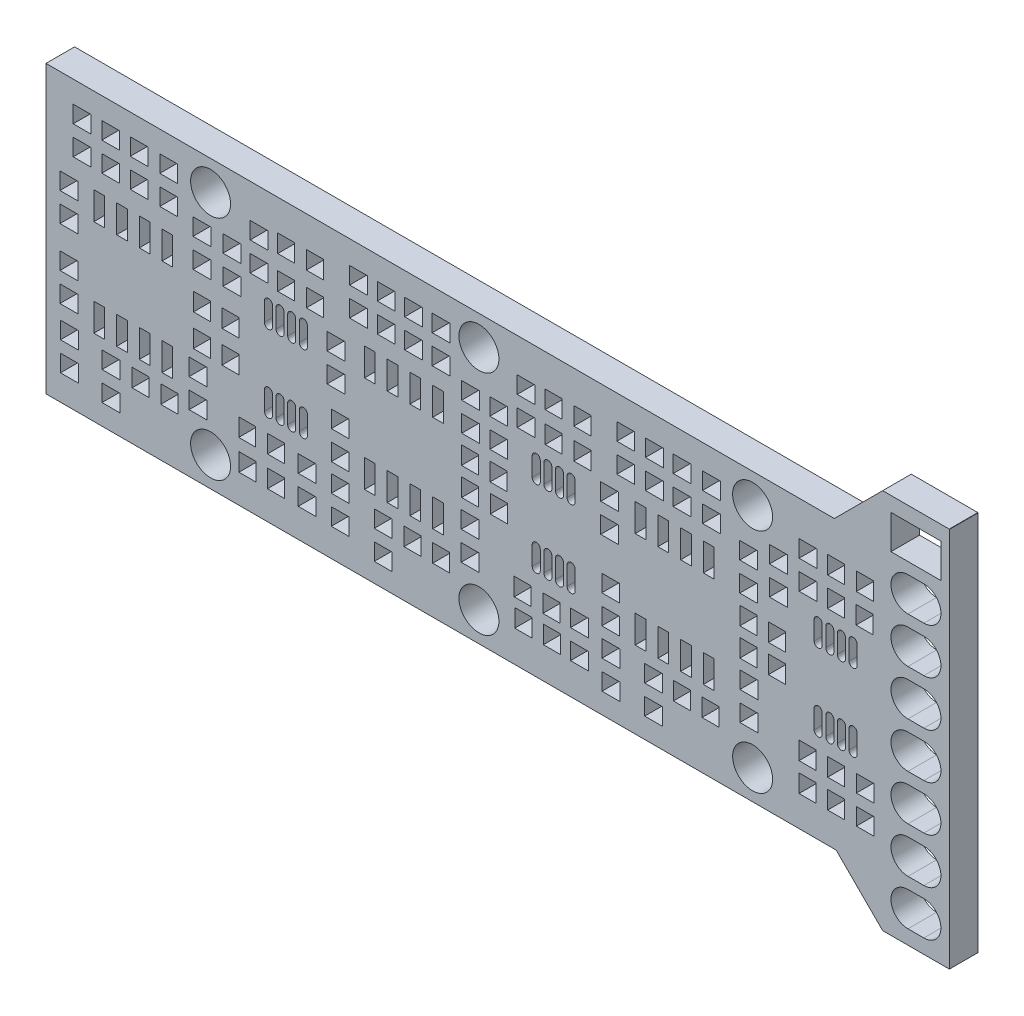
from build123d import *

# Parameters (mm, degrees)
MODEL_R            = 1.1176
MODEL_W            = 2.794
MODEL_H            = 1.905
MODEL_W_2          = 0.6
MODEL_H_2          = 1.55
MODEL_W_3          = 0.95
MODEL_H_3          = 1
MODEL_W_4          = 1
MODEL_H_4          = 0.95
BOSS_EXTRU_1_DEPTH = 1.6


with BuildPart() as part:
    # Model → Boss.-Extru.1 (new body)
    with BuildSketch(Plane.XY):
        Polygon((0, -11.02), (0, 0), (0, 2.69), (-0.01, 2.7), (-3.73, 2.7), (-6.43, 0), (-25, 0), (-35.5, 0), (-50.5, 0), (-50.5, -16), (-35.5, -16), (-6.33, -16), (-3.73, -18.6), (0, -18.6), (0, -16), align=None)
        with Locations((-41.3, -14.35)):
            Circle(MODEL_R, mode=Mode.SUBTRACT)
        with Locations((-41.3, -1.65)):
            Circle(MODEL_R, mode=Mode.SUBTRACT)
        with Locations((-26.3, -14.35)):
            Circle(MODEL_R, mode=Mode.SUBTRACT)
        with Locations((-11, -14.35)):
            Circle(MODEL_R, mode=Mode.SUBTRACT)
        with Locations((-26.3, -1.65)):
            Circle(MODEL_R, mode=Mode.SUBTRACT)
        with Locations((-11, -1.65)):
            Circle(MODEL_R, mode=Mode.SUBTRACT)
        with Locations((-1.87, 0.93)):
            Rectangle(MODEL_W, MODEL_H, mode=Mode.SUBTRACT)
        with BuildLine():
            Line((-1.4255, -2.5625), (-2.3145, -2.5625))
            ThreePointArc((-2.3145, -2.5625), (-3.267, -1.61), (-2.3145, -0.6575))
            Line((-2.3145, -0.6575), (-1.4255, -0.6575))
            ThreePointArc((-1.4255, -0.6575), (-0.473, -1.61), (-1.4255, -2.5625))
        make_face(mode=Mode.SUBTRACT)
        with BuildLine():
            Line((-1.4255, -5.1025), (-2.3145, -5.1025))
            ThreePointArc((-2.3145, -5.1025), (-3.267, -4.15), (-2.3145, -3.1975))
            Line((-2.3145, -3.1975), (-1.4255, -3.1975))
            ThreePointArc((-1.4255, -3.1975), (-0.473, -4.15), (-1.4255, -5.1025))
        make_face(mode=Mode.SUBTRACT)
        with BuildLine():
            Line((-1.4255, -7.6425), (-2.3145, -7.6425))
            ThreePointArc((-2.3145, -7.6425), (-3.267, -6.69), (-2.3145, -5.7375))
            Line((-2.3145, -5.7375), (-1.4255, -5.7375))
            ThreePointArc((-1.4255, -5.7375), (-0.473, -6.69), (-1.4255, -7.6425))
        make_face(mode=Mode.SUBTRACT)
        with BuildLine():
            Line((-1.4255, -10.1825), (-2.3145, -10.1825))
            ThreePointArc((-2.3145, -10.1825), (-3.267, -9.23), (-2.3145, -8.2775))
            Line((-2.3145, -8.2775), (-1.4255, -8.2775))
            ThreePointArc((-1.4255, -8.2775), (-0.473, -9.23), (-1.4255, -10.1825))
        make_face(mode=Mode.SUBTRACT)
        with BuildLine():
            Line((-1.4255, -12.7225), (-2.3145, -12.7225))
            ThreePointArc((-2.3145, -12.7225), (-3.267, -11.77), (-2.3145, -10.8175))
            Line((-2.3145, -10.8175), (-1.4255, -10.8175))
            ThreePointArc((-1.4255, -10.8175), (-0.473, -11.77), (-1.4255, -12.7225))
        make_face(mode=Mode.SUBTRACT)
        with BuildLine():
            Line((-1.4255, -15.2625), (-2.3145, -15.2625))
            ThreePointArc((-2.3145, -15.2625), (-3.267, -14.31), (-2.3145, -13.3575))
            Line((-2.3145, -13.3575), (-1.4255, -13.3575))
            ThreePointArc((-1.4255, -13.3575), (-0.473, -14.31), (-1.4255, -15.2625))
        make_face(mode=Mode.SUBTRACT)
        with BuildLine():
            Line((-1.4255, -17.8025), (-2.3145, -17.8025))
            ThreePointArc((-2.3145, -17.8025), (-3.267, -16.85), (-2.3145, -15.8975))
            Line((-2.3145, -15.8975), (-1.4255, -15.8975))
            ThreePointArc((-1.4255, -15.8975), (-0.473, -16.85), (-1.4255, -17.8025))
        make_face(mode=Mode.SUBTRACT)
        with BuildLine():
            Line((-37.84, -9.685), (-37.84, -10.735))
            ThreePointArc((-37.84, -10.735), (-38.065, -10.96), (-38.29, -10.735))
            Line((-38.29, -10.735), (-38.29, -9.685))
            ThreePointArc((-38.29, -9.685), (-38.065, -9.46), (-37.84, -9.685))
        make_face(mode=Mode.SUBTRACT)
        with BuildLine():
            Line((-37.19, -9.685), (-37.19, -10.735))
            ThreePointArc((-37.19, -10.735), (-37.415, -10.96), (-37.64, -10.735))
            Line((-37.64, -10.735), (-37.64, -9.685))
            ThreePointArc((-37.64, -9.685), (-37.415, -9.46), (-37.19, -9.685))
        make_face(mode=Mode.SUBTRACT)
        with BuildLine():
            Line((-36.54, -9.685), (-36.54, -10.735))
            ThreePointArc((-36.54, -10.735), (-36.765, -10.96), (-36.99, -10.735))
            Line((-36.99, -10.735), (-36.99, -9.685))
            ThreePointArc((-36.99, -9.685), (-36.765, -9.46), (-36.54, -9.685))
        make_face(mode=Mode.SUBTRACT)
        with BuildLine():
            Line((-35.89, -9.685), (-35.89, -10.735))
            ThreePointArc((-35.89, -10.735), (-36.115, -10.96), (-36.34, -10.735))
            Line((-36.34, -10.735), (-36.34, -9.685))
            ThreePointArc((-36.34, -9.685), (-36.115, -9.46), (-35.89, -9.685))
        make_face(mode=Mode.SUBTRACT)
        with BuildLine():
            Line((-35.89, -5.385), (-35.89, -6.435))
            ThreePointArc((-35.89, -6.435), (-36.115, -6.66), (-36.34, -6.435))
            Line((-36.34, -6.435), (-36.34, -5.385))
            ThreePointArc((-36.34, -5.385), (-36.115, -5.16), (-35.89, -5.385))
        make_face(mode=Mode.SUBTRACT)
        with BuildLine():
            Line((-36.54, -5.385), (-36.54, -6.435))
            ThreePointArc((-36.54, -6.435), (-36.765, -6.66), (-36.99, -6.435))
            Line((-36.99, -6.435), (-36.99, -5.385))
            ThreePointArc((-36.99, -5.385), (-36.765, -5.16), (-36.54, -5.385))
        make_face(mode=Mode.SUBTRACT)
        with BuildLine():
            Line((-37.19, -5.385), (-37.19, -6.435))
            ThreePointArc((-37.19, -6.435), (-37.415, -6.66), (-37.64, -6.435))
            Line((-37.64, -6.435), (-37.64, -5.385))
            ThreePointArc((-37.64, -5.385), (-37.415, -5.16), (-37.19, -5.385))
        make_face(mode=Mode.SUBTRACT)
        with BuildLine():
            Line((-37.84, -5.385), (-37.84, -6.435))
            ThreePointArc((-37.84, -6.435), (-38.065, -6.66), (-38.29, -6.435))
            Line((-38.29, -6.435), (-38.29, -5.385))
            ThreePointArc((-38.29, -5.385), (-38.065, -5.16), (-37.84, -5.385))
        make_face(mode=Mode.SUBTRACT)
        with BuildLine():
            Line((-22.87, -9.705), (-22.87, -10.755))
            ThreePointArc((-22.87, -10.755), (-23.095, -10.98), (-23.32, -10.755))
            Line((-23.32, -10.755), (-23.32, -9.705))
            ThreePointArc((-23.32, -9.705), (-23.095, -9.48), (-22.87, -9.705))
        make_face(mode=Mode.SUBTRACT)
        with BuildLine():
            Line((-22.22, -9.705), (-22.22, -10.755))
            ThreePointArc((-22.22, -10.755), (-22.445, -10.98), (-22.67, -10.755))
            Line((-22.67, -10.755), (-22.67, -9.705))
            ThreePointArc((-22.67, -9.705), (-22.445, -9.48), (-22.22, -9.705))
        make_face(mode=Mode.SUBTRACT)
        with BuildLine():
            Line((-21.57, -9.705), (-21.57, -10.755))
            ThreePointArc((-21.57, -10.755), (-21.795, -10.98), (-22.02, -10.755))
            Line((-22.02, -10.755), (-22.02, -9.705))
            ThreePointArc((-22.02, -9.705), (-21.795, -9.48), (-21.57, -9.705))
        make_face(mode=Mode.SUBTRACT)
        with BuildLine():
            Line((-20.92, -9.705), (-20.92, -10.755))
            ThreePointArc((-20.92, -10.755), (-21.145, -10.98), (-21.37, -10.755))
            Line((-21.37, -10.755), (-21.37, -9.705))
            ThreePointArc((-21.37, -9.705), (-21.145, -9.48), (-20.92, -9.705))
        make_face(mode=Mode.SUBTRACT)
        with BuildLine():
            Line((-20.92, -5.405), (-20.92, -6.455))
            ThreePointArc((-20.92, -6.455), (-21.145, -6.68), (-21.37, -6.455))
            Line((-21.37, -6.455), (-21.37, -5.405))
            ThreePointArc((-21.37, -5.405), (-21.145, -5.18), (-20.92, -5.405))
        make_face(mode=Mode.SUBTRACT)
        with BuildLine():
            Line((-21.57, -5.405), (-21.57, -6.455))
            ThreePointArc((-21.57, -6.455), (-21.795, -6.68), (-22.02, -6.455))
            Line((-22.02, -6.455), (-22.02, -5.405))
            ThreePointArc((-22.02, -5.405), (-21.795, -5.18), (-21.57, -5.405))
        make_face(mode=Mode.SUBTRACT)
        with BuildLine():
            Line((-22.22, -5.405), (-22.22, -6.455))
            ThreePointArc((-22.22, -6.455), (-22.445, -6.68), (-22.67, -6.455))
            Line((-22.67, -6.455), (-22.67, -5.405))
            ThreePointArc((-22.67, -5.405), (-22.445, -5.18), (-22.22, -5.405))
        make_face(mode=Mode.SUBTRACT)
        with BuildLine():
            Line((-22.87, -5.405), (-22.87, -6.455))
            ThreePointArc((-22.87, -6.455), (-23.095, -6.68), (-23.32, -6.455))
            Line((-23.32, -6.455), (-23.32, -5.405))
            ThreePointArc((-23.32, -5.405), (-23.095, -5.18), (-22.87, -5.405))
        make_face(mode=Mode.SUBTRACT)
        with BuildLine():
            Line((-7.11, -9.745), (-7.11, -10.795))
            ThreePointArc((-7.11, -10.795), (-7.335, -11.02), (-7.56, -10.795))
            Line((-7.56, -10.795), (-7.56, -9.745))
            ThreePointArc((-7.56, -9.745), (-7.335, -9.52), (-7.11, -9.745))
        make_face(mode=Mode.SUBTRACT)
        with BuildLine():
            Line((-6.46, -9.745), (-6.46, -10.795))
            ThreePointArc((-6.46, -10.795), (-6.685, -11.02), (-6.91, -10.795))
            Line((-6.91, -10.795), (-6.91, -9.745))
            ThreePointArc((-6.91, -9.745), (-6.685, -9.52), (-6.46, -9.745))
        make_face(mode=Mode.SUBTRACT)
        with BuildLine():
            Line((-5.81, -9.745), (-5.81, -10.795))
            ThreePointArc((-5.81, -10.795), (-6.035, -11.02), (-6.26, -10.795))
            Line((-6.26, -10.795), (-6.26, -9.745))
            ThreePointArc((-6.26, -9.745), (-6.035, -9.52), (-5.81, -9.745))
        make_face(mode=Mode.SUBTRACT)
        with BuildLine():
            Line((-5.16, -9.745), (-5.16, -10.795))
            ThreePointArc((-5.16, -10.795), (-5.385, -11.02), (-5.61, -10.795))
            Line((-5.61, -10.795), (-5.61, -9.745))
            ThreePointArc((-5.61, -9.745), (-5.385, -9.52), (-5.16, -9.745))
        make_face(mode=Mode.SUBTRACT)
        with BuildLine():
            Line((-5.16, -5.445), (-5.16, -6.495))
            ThreePointArc((-5.16, -6.495), (-5.385, -6.72), (-5.61, -6.495))
            Line((-5.61, -6.495), (-5.61, -5.445))
            ThreePointArc((-5.61, -5.445), (-5.385, -5.22), (-5.16, -5.445))
        make_face(mode=Mode.SUBTRACT)
        with BuildLine():
            Line((-5.81, -5.445), (-5.81, -6.495))
            ThreePointArc((-5.81, -6.495), (-6.035, -6.72), (-6.26, -6.495))
            Line((-6.26, -6.495), (-6.26, -5.445))
            ThreePointArc((-6.26, -5.445), (-6.035, -5.22), (-5.81, -5.445))
        make_face(mode=Mode.SUBTRACT)
        with BuildLine():
            Line((-6.46, -5.445), (-6.46, -6.495))
            ThreePointArc((-6.46, -6.495), (-6.685, -6.72), (-6.91, -6.495))
            Line((-6.91, -6.495), (-6.91, -5.445))
            ThreePointArc((-6.91, -5.445), (-6.685, -5.22), (-6.46, -5.445))
        make_face(mode=Mode.SUBTRACT)
        with BuildLine():
            Line((-7.11, -5.445), (-7.11, -6.495))
            ThreePointArc((-7.11, -6.495), (-7.335, -6.72), (-7.56, -6.495))
            Line((-7.56, -6.495), (-7.56, -5.445))
            ThreePointArc((-7.56, -5.445), (-7.335, -5.22), (-7.11, -5.445))
        make_face(mode=Mode.SUBTRACT)
        with Locations((-43.715, -5.55)):
            Rectangle(MODEL_W_2, MODEL_H_2, mode=Mode.SUBTRACT)
        with Locations((-44.985, -5.55)):
            Rectangle(MODEL_W_2, MODEL_H_2, mode=Mode.SUBTRACT)
        with Locations((-46.255, -5.55)):
            Rectangle(MODEL_W_2, MODEL_H_2, mode=Mode.SUBTRACT)
        with Locations((-47.525, -5.55)):
            Rectangle(MODEL_W_2, MODEL_H_2, mode=Mode.SUBTRACT)
        with Locations((-47.525, -10.95)):
            Rectangle(MODEL_W_2, MODEL_H_2, mode=Mode.SUBTRACT)
        with Locations((-46.255, -10.95)):
            Rectangle(MODEL_W_2, MODEL_H_2, mode=Mode.SUBTRACT)
        with Locations((-44.985, -10.95)):
            Rectangle(MODEL_W_2, MODEL_H_2, mode=Mode.SUBTRACT)
        with Locations((-43.715, -10.95)):
            Rectangle(MODEL_W_2, MODEL_H_2, mode=Mode.SUBTRACT)
        with Locations((-28.585, -5.55)):
            Rectangle(MODEL_W_2, MODEL_H_2, mode=Mode.SUBTRACT)
        with Locations((-29.855, -5.55)):
            Rectangle(MODEL_W_2, MODEL_H_2, mode=Mode.SUBTRACT)
        with Locations((-31.125, -5.55)):
            Rectangle(MODEL_W_2, MODEL_H_2, mode=Mode.SUBTRACT)
        with Locations((-32.395, -5.55)):
            Rectangle(MODEL_W_2, MODEL_H_2, mode=Mode.SUBTRACT)
        with Locations((-32.395, -10.95)):
            Rectangle(MODEL_W_2, MODEL_H_2, mode=Mode.SUBTRACT)
        with Locations((-31.125, -10.95)):
            Rectangle(MODEL_W_2, MODEL_H_2, mode=Mode.SUBTRACT)
        with Locations((-29.855, -10.95)):
            Rectangle(MODEL_W_2, MODEL_H_2, mode=Mode.SUBTRACT)
        with Locations((-28.585, -10.95)):
            Rectangle(MODEL_W_2, MODEL_H_2, mode=Mode.SUBTRACT)
        with Locations((-13.455, -5.52)):
            Rectangle(MODEL_W_2, MODEL_H_2, mode=Mode.SUBTRACT)
        with Locations((-14.725, -5.52)):
            Rectangle(MODEL_W_2, MODEL_H_2, mode=Mode.SUBTRACT)
        with Locations((-15.995, -5.52)):
            Rectangle(MODEL_W_2, MODEL_H_2, mode=Mode.SUBTRACT)
        with Locations((-17.265, -5.52)):
            Rectangle(MODEL_W_2, MODEL_H_2, mode=Mode.SUBTRACT)
        with Locations((-17.265, -10.92)):
            Rectangle(MODEL_W_2, MODEL_H_2, mode=Mode.SUBTRACT)
        with Locations((-15.995, -10.92)):
            Rectangle(MODEL_W_2, MODEL_H_2, mode=Mode.SUBTRACT)
        with Locations((-14.725, -10.92)):
            Rectangle(MODEL_W_2, MODEL_H_2, mode=Mode.SUBTRACT)
        with Locations((-13.455, -10.92)):
            Rectangle(MODEL_W_2, MODEL_H_2, mode=Mode.SUBTRACT)
        with Locations((-39.25, -12.22)):
            Rectangle(MODEL_W_3, MODEL_H_3, mode=Mode.SUBTRACT)
        with Locations((-37.65, -12.22)):
            Rectangle(MODEL_W_3, MODEL_H_3, mode=Mode.SUBTRACT)
        with Locations((-48.48, -1.69)):
            Rectangle(MODEL_W_4, MODEL_H_4, mode=Mode.SUBTRACT)
        with Locations((-48.48, -3.29)):
            Rectangle(MODEL_W_4, MODEL_H_4, mode=Mode.SUBTRACT)
        with Locations((-49.22, -9.16)):
            Rectangle(MODEL_W_4, MODEL_H_4, mode=Mode.SUBTRACT)
        with Locations((-49.22, -10.76)):
            Rectangle(MODEL_W_4, MODEL_H_4, mode=Mode.SUBTRACT)
        with Locations((-49.19, -12.5)):
            Rectangle(MODEL_W_4, MODEL_H_4, mode=Mode.SUBTRACT)
        with Locations((-49.19, -14.1)):
            Rectangle(MODEL_W_4, MODEL_H_4, mode=Mode.SUBTRACT)
        with Locations((-41.79, -9.19)):
            Rectangle(MODEL_W_3, MODEL_H_3, mode=Mode.SUBTRACT)
        with Locations((-40.19, -9.19)):
            Rectangle(MODEL_W_3, MODEL_H_3, mode=Mode.SUBTRACT)
        with Locations((-46.87, -14.38)):
            Rectangle(MODEL_W_4, MODEL_H_4, mode=Mode.SUBTRACT)
        with Locations((-46.87, -12.78)):
            Rectangle(MODEL_W_4, MODEL_H_4, mode=Mode.SUBTRACT)
        with Locations((-41.78, -7.41)):
            Rectangle(MODEL_W_3, MODEL_H_3, mode=Mode.SUBTRACT)
        with Locations((-40.18, -7.41)):
            Rectangle(MODEL_W_3, MODEL_H_3, mode=Mode.SUBTRACT)
        with Locations((-49.22, -5.29)):
            Rectangle(MODEL_W_4, MODEL_H_4, mode=Mode.SUBTRACT)
        with Locations((-49.22, -6.89)):
            Rectangle(MODEL_W_4, MODEL_H_4, mode=Mode.SUBTRACT)
        with Locations((-43.61, -12.8)):
            Rectangle(MODEL_W_3, MODEL_H_3, mode=Mode.SUBTRACT)
        with Locations((-45.21, -12.8)):
            Rectangle(MODEL_W_3, MODEL_H_3, mode=Mode.SUBTRACT)
        with Locations((-37.07, -4.06)):
            Rectangle(MODEL_W_3, MODEL_H_3, mode=Mode.SUBTRACT)
        with Locations((-35.47, -4.06)):
            Rectangle(MODEL_W_3, MODEL_H_3, mode=Mode.SUBTRACT)
        with Locations((-45.29, -1.67)):
            Rectangle(MODEL_W_4, MODEL_H_4, mode=Mode.SUBTRACT)
        with Locations((-45.29, -3.27)):
            Rectangle(MODEL_W_4, MODEL_H_4, mode=Mode.SUBTRACT)
        with Locations((-40.11, -5.37)):
            Rectangle(MODEL_W_4, MODEL_H_4, mode=Mode.SUBTRACT)
        with Locations((-40.11, -3.77)):
            Rectangle(MODEL_W_4, MODEL_H_4, mode=Mode.SUBTRACT)
        with Locations((-43.64, -3.27)):
            Rectangle(MODEL_W_4, MODEL_H_4, mode=Mode.SUBTRACT)
        with Locations((-43.64, -1.67)):
            Rectangle(MODEL_W_4, MODEL_H_4, mode=Mode.SUBTRACT)
        with Locations((-37.64, -13.9)):
            Rectangle(MODEL_W_3, MODEL_H_3, mode=Mode.SUBTRACT)
        with Locations((-39.24, -13.9)):
            Rectangle(MODEL_W_3, MODEL_H_3, mode=Mode.SUBTRACT)
        with Locations((-42, -10.69)):
            Rectangle(MODEL_W_4, MODEL_H_4, mode=Mode.SUBTRACT)
        with Locations((-42, -12.29)):
            Rectangle(MODEL_W_4, MODEL_H_4, mode=Mode.SUBTRACT)
        with Locations((-41.78, -5.39)):
            Rectangle(MODEL_W_4, MODEL_H_4, mode=Mode.SUBTRACT)
        with Locations((-41.78, -3.79)):
            Rectangle(MODEL_W_4, MODEL_H_4, mode=Mode.SUBTRACT)
        with Locations((-38.59, -2.37)):
            Rectangle(MODEL_W_4, MODEL_H_4, mode=Mode.SUBTRACT)
        with Locations((-38.59, -3.97)):
            Rectangle(MODEL_W_4, MODEL_H_4, mode=Mode.SUBTRACT)
        with Locations((-37.07, -2.23)):
            Rectangle(MODEL_W_3, MODEL_H_3, mode=Mode.SUBTRACT)
        with Locations((-35.47, -2.23)):
            Rectangle(MODEL_W_3, MODEL_H_3, mode=Mode.SUBTRACT)
        with Locations((-35.9, -12.32)):
            Rectangle(MODEL_W_4, MODEL_H_4, mode=Mode.SUBTRACT)
        with Locations((-35.9, -13.92)):
            Rectangle(MODEL_W_4, MODEL_H_4, mode=Mode.SUBTRACT)
        with Locations((-46.88, -3.28)):
            Rectangle(MODEL_W_4, MODEL_H_4, mode=Mode.SUBTRACT)
        with Locations((-46.88, -1.68)):
            Rectangle(MODEL_W_4, MODEL_H_4, mode=Mode.SUBTRACT)
        with Locations((-23.85, -12.24)):
            Rectangle(MODEL_W_3, MODEL_H_3, mode=Mode.SUBTRACT)
        with Locations((-22.25, -12.24)):
            Rectangle(MODEL_W_3, MODEL_H_3, mode=Mode.SUBTRACT)
        with Locations((-33.03, -1.77)):
            Rectangle(MODEL_W_4, MODEL_H_4, mode=Mode.SUBTRACT)
        with Locations((-33.03, -3.37)):
            Rectangle(MODEL_W_4, MODEL_H_4, mode=Mode.SUBTRACT)
        with Locations((-34.05, -9.23)):
            Rectangle(MODEL_W_4, MODEL_H_4, mode=Mode.SUBTRACT)
        with Locations((-34.05, -10.83)):
            Rectangle(MODEL_W_4, MODEL_H_4, mode=Mode.SUBTRACT)
        with Locations((-34.05, -12.36)):
            Rectangle(MODEL_W_4, MODEL_H_4, mode=Mode.SUBTRACT)
        with Locations((-34.05, -13.96)):
            Rectangle(MODEL_W_4, MODEL_H_4, mode=Mode.SUBTRACT)
        with Locations((-26.79, -8.9)):
            Rectangle(MODEL_W_3, MODEL_H_3, mode=Mode.SUBTRACT)
        with Locations((-25.19, -8.9)):
            Rectangle(MODEL_W_3, MODEL_H_3, mode=Mode.SUBTRACT)
        with Locations((-31.65, -12.86)):
            Rectangle(MODEL_W_4, MODEL_H_4, mode=Mode.SUBTRACT)
        with Locations((-31.65, -14.46)):
            Rectangle(MODEL_W_4, MODEL_H_4, mode=Mode.SUBTRACT)
        with Locations((-26.8, -7.35)):
            Rectangle(MODEL_W_3, MODEL_H_3, mode=Mode.SUBTRACT)
        with Locations((-25.2, -7.35)):
            Rectangle(MODEL_W_3, MODEL_H_3, mode=Mode.SUBTRACT)
        with Locations((-34.29, -5.59)):
            Rectangle(MODEL_W_4, MODEL_H_4, mode=Mode.SUBTRACT)
        with Locations((-34.29, -7.19)):
            Rectangle(MODEL_W_4, MODEL_H_4, mode=Mode.SUBTRACT)
        with Locations((-28.41, -12.89)):
            Rectangle(MODEL_W_3, MODEL_H_3, mode=Mode.SUBTRACT)
        with Locations((-30.01, -12.89)):
            Rectangle(MODEL_W_3, MODEL_H_3, mode=Mode.SUBTRACT)
        with Locations((-22.12, -4)):
            Rectangle(MODEL_W_3, MODEL_H_3, mode=Mode.SUBTRACT)
        with Locations((-20.52, -4)):
            Rectangle(MODEL_W_3, MODEL_H_3, mode=Mode.SUBTRACT)
        with Locations((-29.95, -1.77)):
            Rectangle(MODEL_W_4, MODEL_H_4, mode=Mode.SUBTRACT)
        with Locations((-29.95, -3.37)):
            Rectangle(MODEL_W_4, MODEL_H_4, mode=Mode.SUBTRACT)
        with Locations((-25.19, -5.8)):
            Rectangle(MODEL_W_4, MODEL_H_4, mode=Mode.SUBTRACT)
        with Locations((-25.19, -4.2)):
            Rectangle(MODEL_W_4, MODEL_H_4, mode=Mode.SUBTRACT)
        with Locations((-28.41, -3.37)):
            Rectangle(MODEL_W_4, MODEL_H_4, mode=Mode.SUBTRACT)
        with Locations((-28.41, -1.77)):
            Rectangle(MODEL_W_4, MODEL_H_4, mode=Mode.SUBTRACT)
        with Locations((-7.93, -12.21)):
            Rectangle(MODEL_W_3, MODEL_H_3, mode=Mode.SUBTRACT)
        with Locations((-6.33, -12.21)):
            Rectangle(MODEL_W_3, MODEL_H_3, mode=Mode.SUBTRACT)
        with Locations((-18.09, -1.86)):
            Rectangle(MODEL_W_4, MODEL_H_4, mode=Mode.SUBTRACT)
        with Locations((-18.09, -3.46)):
            Rectangle(MODEL_W_4, MODEL_H_4, mode=Mode.SUBTRACT)
        with Locations((-18.93, -9.62)):
            Rectangle(MODEL_W_4, MODEL_H_4, mode=Mode.SUBTRACT)
        with Locations((-18.93, -11.22)):
            Rectangle(MODEL_W_4, MODEL_H_4, mode=Mode.SUBTRACT)
        with Locations((-18.92, -12.78)):
            Rectangle(MODEL_W_4, MODEL_H_4, mode=Mode.SUBTRACT)
        with Locations((-18.92, -14.38)):
            Rectangle(MODEL_W_4, MODEL_H_4, mode=Mode.SUBTRACT)
        with Locations((-11.24, -8.9)):
            Rectangle(MODEL_W_3, MODEL_H_3, mode=Mode.SUBTRACT)
        with Locations((-9.64, -8.9)):
            Rectangle(MODEL_W_3, MODEL_H_3, mode=Mode.SUBTRACT)
        with Locations((-16.53, -12.79)):
            Rectangle(MODEL_W_4, MODEL_H_4, mode=Mode.SUBTRACT)
        with Locations((-16.53, -14.39)):
            Rectangle(MODEL_W_4, MODEL_H_4, mode=Mode.SUBTRACT)
        with Locations((-11.24, -7.34)):
            Rectangle(MODEL_W_3, MODEL_H_3, mode=Mode.SUBTRACT)
        with Locations((-9.64, -7.34)):
            Rectangle(MODEL_W_3, MODEL_H_3, mode=Mode.SUBTRACT)
        with Locations((-18.99, -5.22)):
            Rectangle(MODEL_W_4, MODEL_H_4, mode=Mode.SUBTRACT)
        with Locations((-18.99, -6.82)):
            Rectangle(MODEL_W_4, MODEL_H_4, mode=Mode.SUBTRACT)
        with Locations((-13.35, -12.83)):
            Rectangle(MODEL_W_3, MODEL_H_3, mode=Mode.SUBTRACT)
        with Locations((-14.95, -12.83)):
            Rectangle(MODEL_W_3, MODEL_H_3, mode=Mode.SUBTRACT)
        with Locations((-6.34, -4.05)):
            Rectangle(MODEL_W_3, MODEL_H_3, mode=Mode.SUBTRACT)
        with Locations((-4.74, -4.05)):
            Rectangle(MODEL_W_3, MODEL_H_3, mode=Mode.SUBTRACT)
        with Locations((-14.94, -1.85)):
            Rectangle(MODEL_W_4, MODEL_H_4, mode=Mode.SUBTRACT)
        with Locations((-14.94, -3.45)):
            Rectangle(MODEL_W_4, MODEL_H_4, mode=Mode.SUBTRACT)
        with Locations((-9.56, -5.14)):
            Rectangle(MODEL_W_4, MODEL_H_4, mode=Mode.SUBTRACT)
        with Locations((-9.56, -3.54)):
            Rectangle(MODEL_W_4, MODEL_H_4, mode=Mode.SUBTRACT)
        with Locations((-13.3, -3.45)):
            Rectangle(MODEL_W_4, MODEL_H_4, mode=Mode.SUBTRACT)
        with Locations((-13.3, -1.85)):
            Rectangle(MODEL_W_4, MODEL_H_4, mode=Mode.SUBTRACT)
        with Locations((-22.22, -13.74)):
            Rectangle(MODEL_W_3, MODEL_H_3, mode=Mode.SUBTRACT)
        with Locations((-23.82, -13.74)):
            Rectangle(MODEL_W_3, MODEL_H_3, mode=Mode.SUBTRACT)
        with Locations((-26.79, -10.47)):
            Rectangle(MODEL_W_4, MODEL_H_4, mode=Mode.SUBTRACT)
        with Locations((-26.79, -12.07)):
            Rectangle(MODEL_W_4, MODEL_H_4, mode=Mode.SUBTRACT)
        with Locations((-26.76, -5.81)):
            Rectangle(MODEL_W_4, MODEL_H_4, mode=Mode.SUBTRACT)
        with Locations((-26.76, -4.21)):
            Rectangle(MODEL_W_4, MODEL_H_4, mode=Mode.SUBTRACT)
        with Locations((-23.66, -2.38)):
            Rectangle(MODEL_W_4, MODEL_H_4, mode=Mode.SUBTRACT)
        with Locations((-23.66, -3.98)):
            Rectangle(MODEL_W_4, MODEL_H_4, mode=Mode.SUBTRACT)
        with Locations((-22.12, -2.31)):
            Rectangle(MODEL_W_3, MODEL_H_3, mode=Mode.SUBTRACT)
        with Locations((-20.52, -2.31)):
            Rectangle(MODEL_W_3, MODEL_H_3, mode=Mode.SUBTRACT)
        with Locations((-20.68, -12.18)):
            Rectangle(MODEL_W_4, MODEL_H_4, mode=Mode.SUBTRACT)
        with Locations((-20.68, -13.78)):
            Rectangle(MODEL_W_4, MODEL_H_4, mode=Mode.SUBTRACT)
        with Locations((-31.48, -3.37)):
            Rectangle(MODEL_W_4, MODEL_H_4, mode=Mode.SUBTRACT)
        with Locations((-31.48, -1.77)):
            Rectangle(MODEL_W_4, MODEL_H_4, mode=Mode.SUBTRACT)
        with Locations((-6.33, -13.8)):
            Rectangle(MODEL_W_3, MODEL_H_3, mode=Mode.SUBTRACT)
        with Locations((-7.93, -13.8)):
            Rectangle(MODEL_W_3, MODEL_H_3, mode=Mode.SUBTRACT)
        with Locations((-11.21, -10.44)):
            Rectangle(MODEL_W_4, MODEL_H_4, mode=Mode.SUBTRACT)
        with Locations((-11.21, -12.04)):
            Rectangle(MODEL_W_4, MODEL_H_4, mode=Mode.SUBTRACT)
        with Locations((-11.22, -5.78)):
            Rectangle(MODEL_W_4, MODEL_H_4, mode=Mode.SUBTRACT)
        with Locations((-11.22, -4.18)):
            Rectangle(MODEL_W_4, MODEL_H_4, mode=Mode.SUBTRACT)
        with Locations((-7.9, -2.43)):
            Rectangle(MODEL_W_4, MODEL_H_4, mode=Mode.SUBTRACT)
        with Locations((-7.9, -4.03)):
            Rectangle(MODEL_W_4, MODEL_H_4, mode=Mode.SUBTRACT)
        with Locations((-6.33, -2.42)):
            Rectangle(MODEL_W_3, MODEL_H_3, mode=Mode.SUBTRACT)
        with Locations((-4.73, -2.42)):
            Rectangle(MODEL_W_3, MODEL_H_3, mode=Mode.SUBTRACT)
        with Locations((-4.7, -12.2)):
            Rectangle(MODEL_W_4, MODEL_H_4, mode=Mode.SUBTRACT)
        with Locations((-4.7, -13.8)):
            Rectangle(MODEL_W_4, MODEL_H_4, mode=Mode.SUBTRACT)
        with Locations((-16.49, -3.45)):
            Rectangle(MODEL_W_4, MODEL_H_4, mode=Mode.SUBTRACT)
        with Locations((-16.49, -1.85)):
            Rectangle(MODEL_W_4, MODEL_H_4, mode=Mode.SUBTRACT)
    extrude(amount=BOSS_EXTRU_1_DEPTH)


solid = part.part
